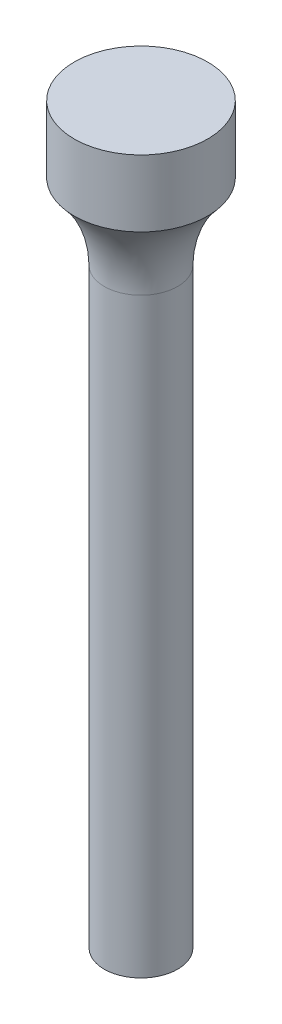
from build123d import *

# Parameters (mm, degrees)
SKETCH1_R           = 1.65
BOSS_EXTRUDE1_DEPTH = 30
SKETCH2_R           = 3
BOSS_EXTRUDE2_DEPTH = 3
FILLET1_R           = 5


with BuildPart() as part:
    # Sketch1 → Boss-Extrude1 (new body)
    with BuildSketch(Plane(origin=(0, 0, 0), x_dir=(1, 0, 0), z_dir=(0, 1, 0))):
        with Locations(Location((0, 0, 0), (0, 0, 270))):
            Circle(SKETCH1_R)
    extrude(amount=BOSS_EXTRUDE1_DEPTH)

    # Sketch2 → Boss-Extrude2 (add)
    with BuildSketch(Plane(origin=(0, 30, 0), x_dir=(1, 0, 0), z_dir=(0, 1, 0))):
        with Locations(Location((0, 0, 0), (0, 0, 270))):
            Circle(SKETCH2_R)
    extrude(amount=BOSS_EXTRUDE2_DEPTH)

    # Fillet1
    # the kernel refuses this fillet: 5 mm, written as the material it adds along each edge
    with BuildSketch(Plane(origin=(0, 30, 0), x_dir=(0, 0, 1), z_dir=(-1, 0, 0))) as fillet1_piece_1:
        with BuildLine():
            CenterArc((6.65, -3.417235725), FILLET1_R, 136.886394054, 43.113605946)
            Line((1.65, -3.417235725), (1.55, -3.417235725))
            Line((1.55, -3.417235725), (1.55, 0))
            Line((1.55, 0), (1.65, 0.1))
            ThreePointArc((1.65, 0.1), (2.325, 0.1), (2.927, 0.068344714))
            Line((2.927, 0.068344714), (3, 0))
        make_face()
    revolve(axis=Axis((0, 30, 0), (0, 1, 0)))


solid = part.part
